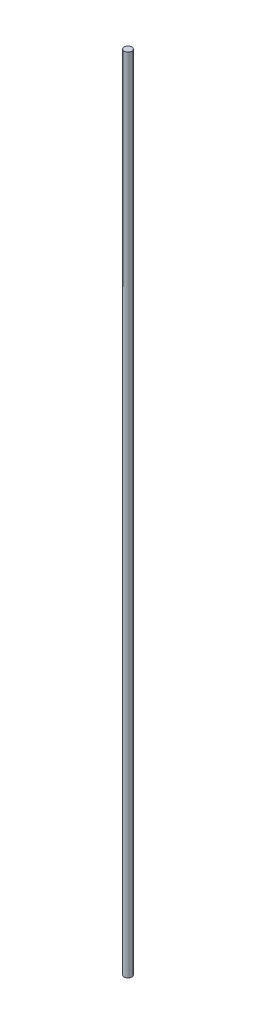
from build123d import *

# Parameters (mm, degrees)
SKETCH_2_W = 2.5
SKETCH_2_H = 529.4


with BuildPart() as part:
    # Эскиз2 → Повернуть1 (revolve)
    with BuildSketch(Plane.XY):
        with Locations((-1.25, 85.322255488)):
            Rectangle(SKETCH_2_W, SKETCH_2_H)
    revolve(axis=Axis((-2.5, 350.022255488, 0), (0, -1, 0)))


solid = part.part
